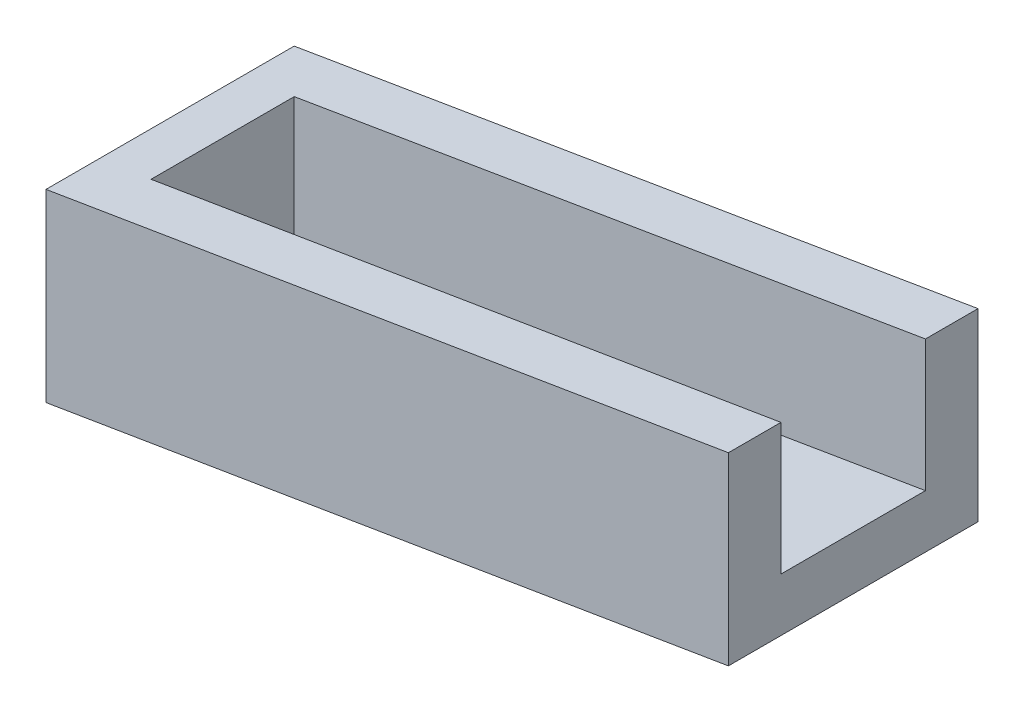
from build123d import *

# Parameters (mm, degrees)
SHELL3_T           = 10
SKETCH5_R          = 8.5
CUT_EXTRUDE1_DEPTH = 10
CHAMFER2_SIZE      = 5


with BuildPart() as part:
    # Sketch4 → Loft3 section 0
    with BuildSketch(Plane(origin=(120, 0, 0), x_dir=(0, 0, -1), z_dir=(1, 0, 0))):
        with BuildLine():
            Line((13.75, 7.5), (-13.75, 7.5))
            Line((-13.75, 7.5), (-13.75, 32.5))
            Line((-13.75, 32.5), (13.75, 32.5))
            Line((13.75, 32.5), (13.75, 7.5))
        make_face()
    # Sketch1 → Loft3 section 1
    with BuildSketch(Plane(origin=(0, 0, 0), x_dir=(0, 0, -1), z_dir=(1, 0, 0))):
        with BuildLine():
            Line((-13.625, -12.5), (13.625, -12.5))
            Line((13.625, -12.5), (13.625, 12.5))
            Line((13.625, 12.5), (-13.625, 12.5))
            Line((-13.625, 12.5), (-13.625, -12.5))
        make_face()
    loft()

    # Shell3
    shell3_openings = [part.faces().sort_by_distance(p)[0] for p in [
        (60.091324201, 22.5152207, 0),
        (120, 20, 0),
    ]]
    offset(amount=SHELL3_T, openings=shell3_openings, kind=Kind.INTERSECTION)

    # Sketch5 → Cut-Extrude1 (cut)
    with BuildSketch(Plane(origin=(2.027027027, -12.162162162, 0), x_dir=(0.9863939238321439, 0.1643989873053572, 0), z_dir=(-0.1643989873053572, 0.9863939238321439, 0))):
        with Locations(Location((8.494520618, 0, 0), (0, 0, 180))):
            Circle(SKETCH5_R)
    extrude(amount=-CUT_EXTRUDE1_DEPTH, mode=Mode.SUBTRACT)

    # Chamfer2
    # the kernel refuses this chamfer: 5 mm, written as the material it takes off along each edge
    with BuildSketch(Plane(origin=(10.40597055, -10.765671575, 0), x_dir=(-0.9863939238321437, -0.1643989873053573, 0), z_dir=(0, 0, -1))) as chamfer2_piece_1_section:
        Polygon((8.5 + CHAMFER2_SIZE, 0), (8.5, -CHAMFER2_SIZE), (8.5, 0), align=None)
    chamfer2_piece_1 = revolve(axis=Axis((10.40597055, -10.765671575, 0), (-0.1643989873053572, 0.9863939238321439, 0)), mode=Mode.PRIVATE)
    chamfer2_piece_1 = split(chamfer2_piece_1, bisect_by=Plane(origin=(0, -11.368477015, 0), z_dir=(1, 0, 0)), keep=Keep.TOP, mode=Mode.PRIVATE)
    add(chamfer2_piece_1, mode=Mode.SUBTRACT)


solid = part.part
